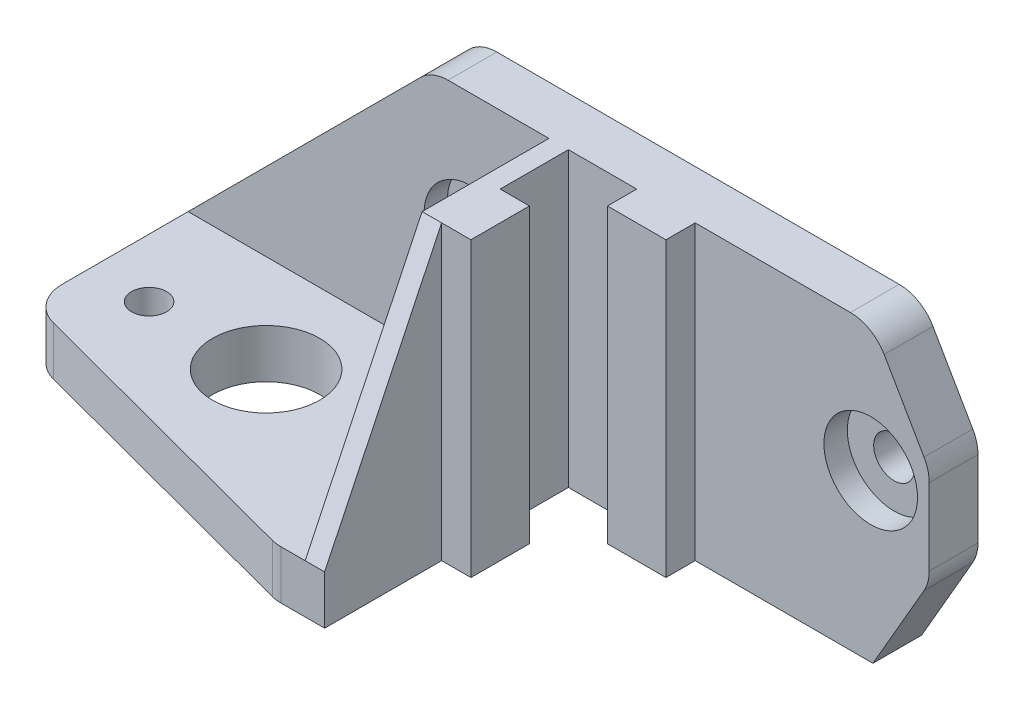
from build123d import *

# Parameters (mm, degrees)
SKETCH1_W                     = 30
SKETCH1_H                     = 30
BOSS_EXTRUDE1_DEPTH           = 30
SKETCH2_W                     = 20
SKETCH2_H                     = 20
CUT_EXTRUDE1_DEPTH            = 37.742346142
SKETCH3_W                     = 30
SKETCH3_H                     = 5
BOSS_EXTRUDE2_DEPTH           = 40
SKETCH4_R                     = 5.5
SKETCH4_R_2                   = 1.8
CUT_EXTRUDE2_DEPTH            = 65.420493634
CUT_EXTRUDE3_DEPTH            = 63.24949799
SKETCH5_W                     = 5
SKETCH5_H                     = 25
BOSS_EXTRUDE4_DEPTH           = 34
CHAMFER1_SIZE                 = 25
SKETCH8_R                     = 2.1
CUT_EXTRUDE4_DEPTH            = 63.657800791
SKETCH9_W                     = 5
SKETCH9_H                     = 30
BOSS_EXTRUDE5_DEPTH           = 12
CHAMFER2_SIZE                 = 10
CHAMFER2_SIZE2                = 5.773502692
SKETCH10_R                    = 2.1
CUT_EXTRUDE5_DEPTH            = 63.657800791
BODY_MOVE_COPY1_START         = -15
BODY_MOVE_COPY1_DEPTH         = 31
BODY_MOVE_COPY1_START_2       = -10
BODY_MOVE_COPY1_2_DEPTH       = 26
BODY_MOVE_COPY1_3_OUTLINE_W   = 34
BODY_MOVE_COPY1_3_OUTLINE_H   = 5
BODY_MOVE_COPY1_3_DEPTH       = 30
BODY_MOVE_COPY1_4_DEPTH       = 5
BODY_MOVE_COPY1_5_OUTLINE_R   = 5.5
BODY_MOVE_COPY1_5_OUTLINE_R_2 = 1.8
BODY_MOVE_COPY1_5_DEPTH       = 5
SKETCH11_W                    = 3
SKETCH11_H                    = 25
CUT_EXTRUDE6_DEPTH            = 25
SKETCH12_W                    = 25
SKETCH12_H                    = 25
CUT_EXTRUDE7_DEPTH            = 60.380131357
SKETCH13_W                    = 3
SKETCH13_H                    = 6
SKETCH13_W_2                  = 6
SKETCH13_H_2                  = 3
BOSS_EXTRUDE6_DEPTH           = 30
SKETCH14_R                    = 4.8
CUT_EXTRUDE9_DEPTH            = 2.4
CHAMFER3_SIZE                 = 12
CHAMFER3_SIZE2                = 25
FILLET1_R                     = 4
FILLET2_R                     = 4


with BuildPart() as part:
    # Sketch1 → Boss-Extrude1 (new body)
    with BuildSketch(Plane(origin=(0, 0, 0), x_dir=(1, 0, 0), z_dir=(0, 1, 0))):
        Rectangle(SKETCH1_W, SKETCH1_H)
    extrude(amount=BOSS_EXTRUDE1_DEPTH)

    # Sketch2 → Cut-Extrude1 (cut, through all)
    with BuildSketch(Plane(origin=(0, 30, 0), x_dir=(1, 0, 0), z_dir=(0, 1, 0))):
        Rectangle(SKETCH2_W, SKETCH2_H)
    extrude(amount=-CUT_EXTRUDE1_DEPTH, mode=Mode.SUBTRACT)

    # Sketch3 → Boss-Extrude2 (add)
    with BuildSketch(Plane(origin=(15, 0, 0), x_dir=(0, 0, -1), z_dir=(1, 0, 0))):
        with Locations((0, 2.5)):
            Rectangle(SKETCH3_W, SKETCH3_H)
    extrude(amount=BOSS_EXTRUDE2_DEPTH)

    # Sketch4 → Cut-Extrude2 (cut, through all)
    with BuildSketch(Plane.XZ):
        with Locations(Location((31, 0, 0), (0, 0, 270))):
            Circle(SKETCH4_R)
        with Locations(Location((19, 0, 0), (0, 0, 270))):
            Circle(SKETCH4_R_2)
        with Locations(Location((43, 0, 0), (0, 0, 270))):
            Circle(SKETCH4_R_2)
    extrude(amount=-CUT_EXTRUDE2_DEPTH, mode=Mode.SUBTRACT)

    # Sketch7 → Cut-Extrude3 (cut, through all)
    with BuildSketch(Plane(origin=(0, 5, 0), x_dir=(1, 0, 0), z_dir=(0, 1, 0))):
        Polygon((15, -15), (49, -6), (49, 15), (55, 15), (55, -15), align=None)
    extrude(amount=-CUT_EXTRUDE3_DEPTH, mode=Mode.SUBTRACT)

    # Sketch5 → Boss-Extrude4 (add)
    with BuildSketch(Plane(origin=(15, 0, 0), x_dir=(0, 0, -1), z_dir=(1, 0, 0))):
        with Locations((12.5, 17.5)):
            Rectangle(SKETCH5_W, SKETCH5_H)
    extrude(amount=BOSS_EXTRUDE4_DEPTH)

    # Chamfer1
    chamfer1_edges = [part.edges().sort_by_distance(p)[0] for p in [
        (49, 30, -12.5),
    ]]
    chamfer(chamfer1_edges, length=CHAMFER1_SIZE)

    # Sketch8 → Cut-Extrude4 (cut, through all)
    with BuildSketch(Plane.XY.offset(-10)):
        with Locations((20, 17)):
            Circle(SKETCH8_R)
    extrude(amount=-CUT_EXTRUDE4_DEPTH, mode=Mode.SUBTRACT)

    # Sketch9 → Boss-Extrude5 (add)
    with BuildSketch(Plane.ZY.offset(15)):
        with Locations((-12.5, 15)):
            Rectangle(SKETCH9_W, SKETCH9_H)
    extrude(amount=BOSS_EXTRUDE5_DEPTH)

    # Chamfer2
    chamfer2_edges = [part.edges().sort_by_distance(p)[0] for p in [
        (-27, 30, -12.5),
        (-27, 0, -12.5),
    ]]
    chamfer2_side = [part.faces().sort_by_distance(p)[0] for p in [
        (-27, 15, -12.5),
    ]]
    chamfer(chamfer2_edges, length=CHAMFER2_SIZE, length2=CHAMFER2_SIZE2, reference=chamfer2_side[0])

    # Sketch10 → Cut-Extrude5 (cut, through all)
    with BuildSketch(Plane.XY.offset(-10)):
        with Locations((-21, 17)):
            Circle(SKETCH10_R)
    extrude(amount=-CUT_EXTRUDE5_DEPTH, mode=Mode.SUBTRACT)

    # Body-Move/Copy1: read off the stored shape, not the designer's step
    # Body-Move/Copy1 outline → Body-Move/Copy1 (cut)
    with BuildSketch(Plane.XY.offset(BODY_MOVE_COPY1_START)):
        Polygon((24, 30), (21.226497308, 30), (27, 20), (27, 10), (21.226497308, 0), (49, 0), (49, 5), align=None)
        with BuildLine():
            ThreePointArc((-20.5, 14.960392195), (-17.9, 17), (-20.5, 19.039607805))
            ThreePointArc((-20.5, 19.039607805), (-18.9, 17), (-20.5, 14.960392195))
        make_face()
        with BuildLine():
            ThreePointArc((20.5, 14.960392195), (23.1, 17), (20.5, 19.039607805))
            ThreePointArc((20.5, 19.039607805), (22.1, 17), (20.5, 14.960392195))
        make_face()
    extrude(amount=BODY_MOVE_COPY1_DEPTH, mode=Mode.SUBTRACT)

    # Body-Move_Copy1 2 outline → Body-Move_Copy1 2 (cut)
    with BuildSketch(Plane.XY.offset(BODY_MOVE_COPY1_START_2)):
        Polygon((24.113248654, 5), (15, 5), (15, 0), (21.226497308, 0), align=None)
    extrude(amount=BODY_MOVE_COPY1_2_DEPTH, mode=Mode.SUBTRACT)

    # Body-Move_Copy1 3 outline → Body-Move_Copy1 3 (add)
    with BuildSketch(Plane.XY.offset(BODY_MOVE_COPY1_START)):
        with Locations((-32, 2.5)):
            Rectangle(BODY_MOVE_COPY1_3_OUTLINE_W, BODY_MOVE_COPY1_3_OUTLINE_H)
    extrude(amount=BODY_MOVE_COPY1_3_DEPTH)

    # Body-Move_Copy1 4 outline → Body-Move_Copy1 4 (add)
    with BuildSketch(Plane.XY.offset(BODY_MOVE_COPY1_START)):
        Polygon((-27, 20), (-21.226497308, 30), (-24, 30), (-49, 5), (-24.113248654, 5), (-27, 10), align=None)
        with BuildLine():
            ThreePointArc((-20.5, 14.960392195), (-22.1, 17), (-20.5, 19.039607805))
            ThreePointArc((-20.5, 19.039607805), (-23.1, 17), (-20.5, 14.960392195))
        make_face()
        with BuildLine():
            ThreePointArc((20.5, 14.960392195), (18.9, 17), (20.5, 19.039607805))
            ThreePointArc((20.5, 19.039607805), (17.9, 17), (20.5, 14.960392195))
        make_face()
    extrude(amount=BODY_MOVE_COPY1_4_DEPTH)

    # Body-Move_Copy1 5 outline → Body-Move_Copy1 5 (cut)
    with BuildSketch(Plane(origin=(0, 0, 0), x_dir=(1, 0, 0), z_dir=(0, 1, 0))):
        with Locations((-31, 0)):
            Circle(BODY_MOVE_COPY1_5_OUTLINE_R)
        with Locations((-19, 0)):
            Circle(BODY_MOVE_COPY1_5_OUTLINE_R_2)
        with Locations((-43, 0)):
            Circle(BODY_MOVE_COPY1_5_OUTLINE_R_2)
        Polygon((-49, -15), (-15, -15), (-49, -6), align=None)
    extrude(amount=BODY_MOVE_COPY1_5_DEPTH, mode=Mode.SUBTRACT)

    # Sketch11 → Cut-Extrude6 (cut)
    with BuildSketch(Plane(origin=(0, 30, 0), x_dir=(1, 0, 0), z_dir=(0, 1, 0))):
        with Locations((-13.5, -2.5)):
            Rectangle(SKETCH11_W, SKETCH11_H)
    extrude(amount=-CUT_EXTRUDE6_DEPTH, mode=Mode.SUBTRACT)

    # Sketch12 → Cut-Extrude7 (cut, through all)
    with BuildSketch(Plane(origin=(0, 30, 0), x_dir=(1, 0, 0), z_dir=(0, 1, 0))):
        with Locations((2.5, -2.5)):
            Rectangle(SKETCH12_W, SKETCH12_H)
    extrude(amount=-CUT_EXTRUDE7_DEPTH, mode=Mode.SUBTRACT)

    # Sketch13 → Boss-Extrude6 (add)
    with BuildSketch(Plane(origin=(0, 30, 0), x_dir=(1, 0, 0), z_dir=(0, 1, 0))):
        with Locations((-8.5, 0)):
            Rectangle(SKETCH13_W, SKETCH13_H)
        with Locations((0, 8.5)):
            Rectangle(SKETCH13_W_2, SKETCH13_H_2)
    extrude(amount=-BOSS_EXTRUDE6_DEPTH)

    # Sketch14 → Cut-Extrude9 (cut)
    with BuildSketch(Plane.XY.offset(-10)):
        with Locations((-20, 17)):
            Circle(SKETCH14_R)
        with Locations((21, 17)):
            Circle(SKETCH14_R)
    extrude(amount=-CUT_EXTRUDE9_DEPTH, mode=Mode.SUBTRACT)

    # Chamfer3
    chamfer3_edges = [part.edges().sort_by_distance(p)[0] for p in [
        (-11, 30, 15),
    ]]
    chamfer3_side = [part.faces().sort_by_distance(p)[0] for p in [
        (-18, 30, -10.542718717),
    ]]
    chamfer(chamfer3_edges, length=CHAMFER3_SIZE, length2=CHAMFER3_SIZE2, reference=chamfer3_side[0])

    # Fillet1
    fillet1_edges = [part.edges().sort_by_distance(p)[0] for p in [
        (-49, 2.5, 6),
        (-15, 2.5, 15),
    ]]
    fillet(fillet1_edges, radius=FILLET1_R)

    # Fillet2
    fillet2_edges = [part.edges().sort_by_distance(p)[0] for p in [
        (27, 10, -12.5),
        (27, 20, -12.5),
        (21.226497308, 30, -12.5),
        (-24, 30, -12.5),
    ]]
    fillet(fillet2_edges, radius=FILLET2_R)


solid = part.part
